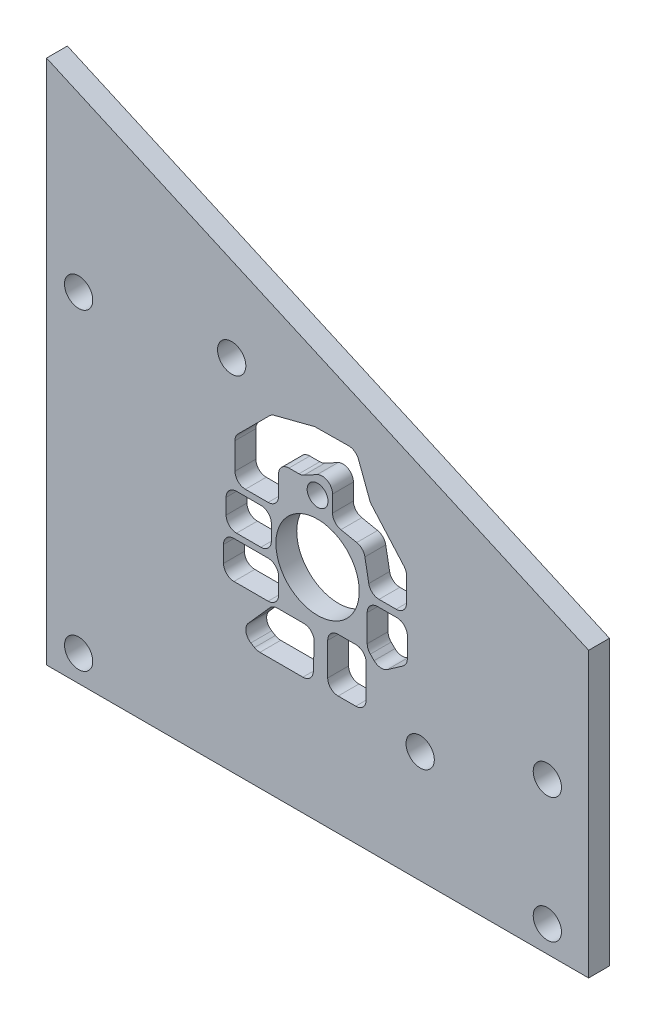
from build123d import *

# Parameters (mm, degrees)
BOSS_EXTRUDE1_DEPTH          = 3.175
F_6_CLEARANCE_HOLE1_D        = 4.3053
F_1_2_0_5_DIAMETER_HOLE1_D   = 12.7
F_1_8_0_125_DIAMETER_HOLE1_D = 3.175
CUT_EXTRUDE1_DEPTH           = 127.083883288
SKETCH10_W                   = 82.55
SKETCH10_H                   = 13.462
CUT_EXTRUDE2_DEPTH           = 125.775859018
CUT_EXTRUDE3_DEPTH           = 125.775859018


with BuildPart() as part:
    # Sketch1 → Boss-Extrude1 (new body)
    with BuildSketch(Plane.XY):
        with BuildLine():
            Line((49.022, 13.462), (57.658, 13.462))
            ThreePointArc((57.658, 13.462), (61.250102448, 11.974102448), (62.738, 8.382))
            Line((62.738, 8.382), (62.738, 0))
            Line((62.738, 0), (82.55, 0))
            Line((82.55, 0), (82.55, 58.42))
            Line((82.55, 58.42), (0, 95.25))
            Line((0, 95.25), (0, 0))
            Line((0, 0), (43.942, 0))
            Line((43.942, 0), (43.942, 8.382))
            ThreePointArc((43.942, 8.382), (45.429897552, 11.974102448), (49.022, 13.462))
        make_face()
    extrude(amount=-BOSS_EXTRUDE1_DEPTH)

    # #6 Clearance Hole1 (through all)
    with Locations(Plane(origin=(0, 0, -3.175), x_dir=(-1, 0, 0), z_dir=(0, 0, -1))):
        with Locations((-4.8895, 17.4625), (-4.8895, 65.0875), (-76.2635, 36.5125), (-76.2635, 17.4625), (-28.194, 68.072), (-56.896, 30.48)):
            Hole(F_6_CLEARANCE_HOLE1_D / 2)

    # 1/2 (0.5) Diameter Hole1 (through all)
    with Locations(Plane(origin=(0, 0, -3.175), x_dir=(-1, 0, 0), z_dir=(0, 0, -1))):
        with Locations((-41.275, 46.99)):
            Hole(F_1_2_0_5_DIAMETER_HOLE1_D / 2)

    # 1/8 (0.125) Diameter Hole1 (through all)
    with Locations(Plane.XY):
        with Locations((41.275, 56.488873013)):
            Hole(F_1_8_0_125_DIAMETER_HOLE1_D / 2)

    # Sketch9 → Cut-Extrude1 (cut, through all)
    with BuildSketch(Plane.XY):
        Polygon((82.55, 56.681667019), (0, 93.511667019), (0, 95.25), (82.55, 58.42), align=None)
    extrude(amount=-CUT_EXTRUDE1_DEPTH, mode=Mode.SUBTRACT)

    # Sketch10 → Cut-Extrude2 (cut, through all)
    with BuildSketch(Plane.XY):
        with Locations((41.275, 6.731)):
            Rectangle(SKETCH10_W, SKETCH10_H)
    extrude(amount=-CUT_EXTRUDE2_DEPTH, mode=Mode.SUBTRACT)

    # Sketch11 → Cut-Extrude3 (cut, through all)
    with BuildSketch(Plane(origin=(0, 0, -3.175), x_dir=(-1, 0, 0), z_dir=(0, 0, -1))):
        with BuildLine():
            Line((-47.499382893, 64.350043571), (-49.217838976, 59.797014184))
            ThreePointArc((-49.217838976, 59.797014184), (-49.342602584, 59.539490696), (-49.511570199, 59.308548605))
            Line((-49.511570199, 59.308548605), (-54.424737937, 53.728160557))
            ThreePointArc((-54.424737937, 53.728160557), (-54.718441496, 53.239768266), (-54.820737184, 52.679121851))
            Line((-54.820737184, 52.679121851), (-54.820737184, 49.028223087))
            ThreePointArc((-54.820737184, 49.028223087), (-54.355769199, 47.905691072), (-53.233237184, 47.440723087))
            Line((-53.233237184, 47.440723087), (-50.632018094, 47.440723087))
            ThreePointArc((-50.632018094, 47.440723087), (-49.615422508, 47.808924245), (-49.070400683, 48.742728232))
            Line((-49.070400683, 48.742728232), (-48.481044321, 51.966426108))
            ThreePointArc((-48.481044321, 51.966426108), (-48.053344478, 52.791961047), (-47.236701236, 53.236403289))
            Line((-47.236701236, 53.236403289), (-44.826272839, 53.728065645))
            ThreePointArc((-44.826272839, 53.728065645), (-43.913947791, 54.279425321), (-43.556047165, 55.28353768))
            Line((-43.556047165, 55.28353768), (-43.556047165, 57.78867138))
            ThreePointArc((-43.556047165, 57.78867138), (-42.781378772, 59.152291939), (-41.213419098, 59.185073132))
            Line((-41.213419098, 59.185073132), (-39.194265812, 58.093181549))
            ThreePointArc((-39.194265812, 58.093181549), (-38.828604347, 57.950599215), (-38.439137744, 57.902083301))
            Line((-38.439137744, 57.902083301), (-36.91898292, 57.902083301))
            ThreePointArc((-36.91898292, 57.902083301), (-35.796450905, 57.437115316), (-35.33148292, 56.314583301))
            Line((-35.33148292, 56.314583301), (-35.33148292, 53.371319843))
            ThreePointArc((-35.33148292, 53.371319843), (-34.866514936, 52.248787828), (-33.74398292, 51.783819843))
            Line((-33.74398292, 51.783819843), (-30.284464792, 51.783819843))
            ThreePointArc((-30.284464792, 51.783819843), (-29.161932777, 52.248787828), (-28.696964792, 53.371319843))
            Line((-28.696964792, 53.371319843), (-28.696964792, 57.39464551))
            ThreePointArc((-28.696964792, 57.39464551), (-28.817806034, 58.002155459), (-29.161932777, 58.517177525))
            Line((-29.161932777, 58.517177525), (-33.960282123, 63.315526871))
            ThreePointArc((-33.960282123, 63.315526871), (-34.294903906, 63.571165279), (-34.684964472, 63.729833134))
            Line((-34.684964472, 63.729833134), (-40.63768141, 65.270845279))
            ThreePointArc((-40.63768141, 65.270845279), (-40.826231645, 65.307649272), (-41.017846908, 65.3214085))
            Line((-41.017846908, 65.3214085), (-45.99646675, 65.376871943))
            ThreePointArc((-45.99646675, 65.376871943), (-46.909705645, 65.100248069), (-47.499382893, 64.350043571))
        make_face()
        with BuildLine():
            Line((-32.646432346, 50.840755102), (-28.930085764, 50.840755102))
            ThreePointArc((-28.930085764, 50.840755102), (-27.807553749, 50.375787118), (-27.342585764, 49.253255102))
            Line((-27.342585764, 49.253255102), (-27.342585764, 46.905517071))
            ThreePointArc((-27.342585764, 46.905517071), (-27.807553749, 45.782985055), (-28.930085764, 45.318017071))
            Line((-28.930085764, 45.318017071), (-32.646432346, 45.318017071))
            ThreePointArc((-32.646432346, 45.318017071), (-33.768964361, 45.782985055), (-34.233932346, 46.905517071))
            Line((-34.233932346, 46.905517071), (-34.233932346, 49.253255102))
            ThreePointArc((-34.233932346, 49.253255102), (-33.768964361, 50.375787118), (-32.646432346, 50.840755102))
        make_face()
        with BuildLine():
            Line((-35.33148292, 42.840265572), (-35.33148292, 40.343410335))
            ThreePointArc((-35.33148292, 40.343410335), (-34.866514936, 39.22087832), (-33.74398292, 38.755910335))
            Line((-33.74398292, 38.755910335), (-28.540105865, 38.755910335))
            ThreePointArc((-28.540105865, 38.755910335), (-27.41757385, 39.22087832), (-26.952605865, 40.343410335))
            Line((-26.952605865, 40.343410335), (-26.952605865, 42.840265572))
            ThreePointArc((-26.952605865, 42.840265572), (-27.41757385, 43.962797587), (-28.540105865, 44.427765572))
            Line((-28.540105865, 44.427765572), (-33.74398292, 44.427765572))
            ThreePointArc((-33.74398292, 44.427765572), (-34.866514936, 43.962797587), (-35.33148292, 42.840265572))
        make_face()
        with BuildLine():
            Line((-39.176026782, 38.541010778), (-35.181004031, 38.541010778))
            ThreePointArc((-35.181004031, 38.541010778), (-34.531156367, 38.401907914), (-33.995193013, 38.008976779))
            Line((-33.995193013, 38.008976779), (-30.745595247, 34.358069187))
            ThreePointArc((-30.745595247, 34.358069187), (-30.362092779, 33.062996361), (-31.114583127, 31.941369845))
            Line((-31.114583127, 31.941369845), (-31.672176066, 31.606780028))
            ThreePointArc((-31.672176066, 31.606780028), (-32.065207793, 31.438125436), (-32.488999204, 31.38051337))
            Line((-32.488999204, 31.38051337), (-39.038910223, 31.38051337))
            ThreePointArc((-39.038910223, 31.38051337), (-40.141975129, 31.82634614), (-40.625471552, 32.913429511))
            Line((-40.625471552, 32.913429511), (-40.762588111, 36.898926919))
            ThreePointArc((-40.762588111, 36.898926919), (-40.317694012, 38.056575684), (-39.176026782, 38.541010778))
        make_face()
        with BuildLine():
            Line((-42.817574391, 33.165238566), (-42.817574391, 38.125040876))
            ThreePointArc((-42.817574391, 38.125040876), (-43.282542376, 39.247572891), (-44.405074391, 39.712540876))
            Line((-44.405074391, 39.712540876), (-47.083309533, 39.712540876))
            ThreePointArc((-47.083309533, 39.712540876), (-48.205841548, 39.247572891), (-48.670809533, 38.125040876))
            Line((-48.670809533, 38.125040876), (-48.670809533, 33.165238566))
            ThreePointArc((-48.670809533, 33.165238566), (-48.205841548, 32.042706551), (-47.083309533, 31.577738566))
            Line((-47.083309533, 31.577738566), (-44.405074391, 31.577738566))
            ThreePointArc((-44.405074391, 31.577738566), (-43.282542376, 32.042706551), (-42.817574391, 33.165238566))
        make_face()
        with BuildLine():
            Line((-49.887230399, 38.986758496), (-49.307899355, 39.555613781))
            ThreePointArc((-49.307899355, 39.555613781), (-48.956271181, 40.074146218), (-48.832643382, 40.688340347))
            Line((-48.832643382, 40.688340347), (-48.832643382, 44.797069188))
            ThreePointArc((-48.832643382, 44.797069188), (-49.297611367, 45.919601203), (-50.420143382, 46.384569188))
            Line((-50.420143382, 46.384569188), (-53.357849589, 46.384569188))
            ThreePointArc((-53.357849589, 46.384569188), (-54.480381604, 45.919601203), (-54.945349589, 44.797069188))
            Line((-54.945349589, 44.797069188), (-54.945349589, 41.767945485))
            ThreePointArc((-54.945349589, 41.767945485), (-54.76567745, 41.03434003), (-54.267331367, 40.466792479))
            Line((-54.267331367, 40.466792479), (-51.908956205, 38.818332055))
            ThreePointArc((-51.908956205, 38.818332055), (-50.867679135, 38.537465387), (-49.887230399, 38.986758496))
        make_face()
    extrude(amount=-CUT_EXTRUDE3_DEPTH, mode=Mode.SUBTRACT)


solid = part.part
